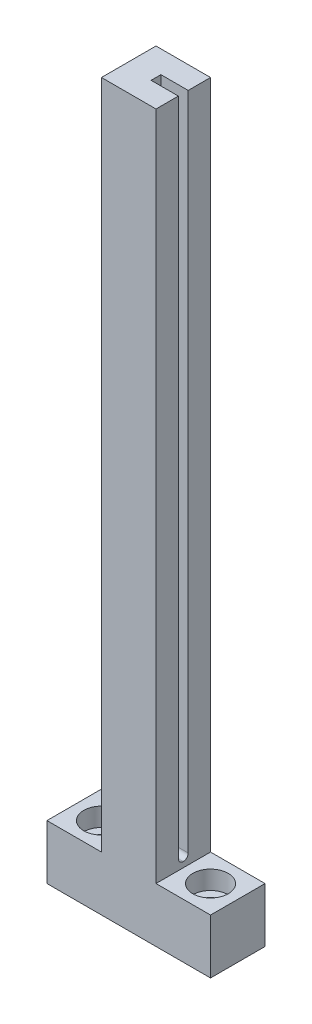
from build123d import *

# Parameters (mm, degrees)
SKETCH1_W                                           = 10
SKETCH1_H                                           = 10
BOSS_EXTRUDE1_DEPTH                                 = 133
SKETCH3_W                                           = 1.8
SKETCH3_H                                           = 122
CUT_EXTRUDE1_DEPTH                                  = 5
FILLET1_R                                           = 0.9
SKETCH4_W                                           = 10
SKETCH4_H                                           = 10
BOSS_EXTRUDE3_DEPTH                                 = 15
CBORE_FOR_M3_HEX_SOCKET_HEAD_CAP_SCREW1_D           = 3.4
CBORE_FOR_M3_HEX_SOCKET_HEAD_CAP_SCREW1_CBORE_D     = 6.5
CBORE_FOR_M3_HEX_SOCKET_HEAD_CAP_SCREW1_CBORE_DEPTH = 3.4
F_1_0MM_DOWEL_HOLE1_D                               = 1
F_1_0MM_DOWEL_HOLE1_DEPTH                           = 8
F_1_0MM_DOWEL_HOLE1_TIP                             = 0.30043031


with BuildPart() as part:
    # Sketch1 → Boss-Extrude1 (new body)
    with BuildSketch(Plane(origin=(0, 0, 0), x_dir=(1, 0, 0), z_dir=(0, 1, 0))):
        Rectangle(SKETCH1_W, SKETCH1_H)
    extrude(amount=BOSS_EXTRUDE1_DEPTH)

    # Sketch3 → Cut-Extrude1 (cut)
    with BuildSketch(Plane(origin=(5, 0, 0), x_dir=(0, 0, -1), z_dir=(1, 0, 0))):
        with Locations((0, 72)):
            Rectangle(SKETCH3_W, SKETCH3_H)
    extrude(amount=-CUT_EXTRUDE1_DEPTH, mode=Mode.SUBTRACT)

    # Fillet1
    fillet1_edges = [part.edges().sort_by_distance(p)[0] for p in [
        (2.5, 11, 0.9),
        (2.5, 11, -0.9),
    ]]
    fillet(fillet1_edges, radius=FILLET1_R - 0.0001)  # a hair under: the kernel refuses the full size

    # Sketch4 → Boss-Extrude3 (add, symmetric)
    with BuildSketch(Plane(origin=(0, 0, 0), x_dir=(0, 0, -1), z_dir=(1, 0, 0))):
        with Locations((0, 5)):
            Rectangle(SKETCH4_W, SKETCH4_H)
    extrude(amount=BOSS_EXTRUDE3_DEPTH, both=True)

    # CBORE for M3 Hex Socket Head Cap Screw1 (through all)
    with Locations(Plane(origin=(10, 10, 0), x_dir=(0, 0, 1), z_dir=(0, 1, 0))):
        with Locations((0, 0)):
            cbore_for_m3_hex_socket_head_cap_screw1 = CounterBoreHole(CBORE_FOR_M3_HEX_SOCKET_HEAD_CAP_SCREW1_D / 2, CBORE_FOR_M3_HEX_SOCKET_HEAD_CAP_SCREW1_CBORE_D / 2, CBORE_FOR_M3_HEX_SOCKET_HEAD_CAP_SCREW1_CBORE_DEPTH)

    # Mirror1: CBORE for M3 Hex Socket Head Cap Screw1 across plane
    add(cbore_for_m3_hex_socket_head_cap_screw1.mirror(Plane(origin=(0, 0, 0), x_dir=(0, 0, 1), z_dir=(1, 0, 0))), mode=Mode.SUBTRACT)

    # Ø1.0mm Dowel Hole1
    with Locations(Plane(origin=(0, 0, 0), x_dir=(0, 0, -1), z_dir=(0, -1, 0))):
        with Locations((0, 0)):
            Hole(F_1_0MM_DOWEL_HOLE1_D / 2, depth=F_1_0MM_DOWEL_HOLE1_DEPTH)
            with Locations((0, 0, -(F_1_0MM_DOWEL_HOLE1_DEPTH + F_1_0MM_DOWEL_HOLE1_TIP / 2))):  # 118° drill point
                Cone(0, F_1_0MM_DOWEL_HOLE1_D / 2, F_1_0MM_DOWEL_HOLE1_TIP, mode=Mode.SUBTRACT)


solid = part.part
